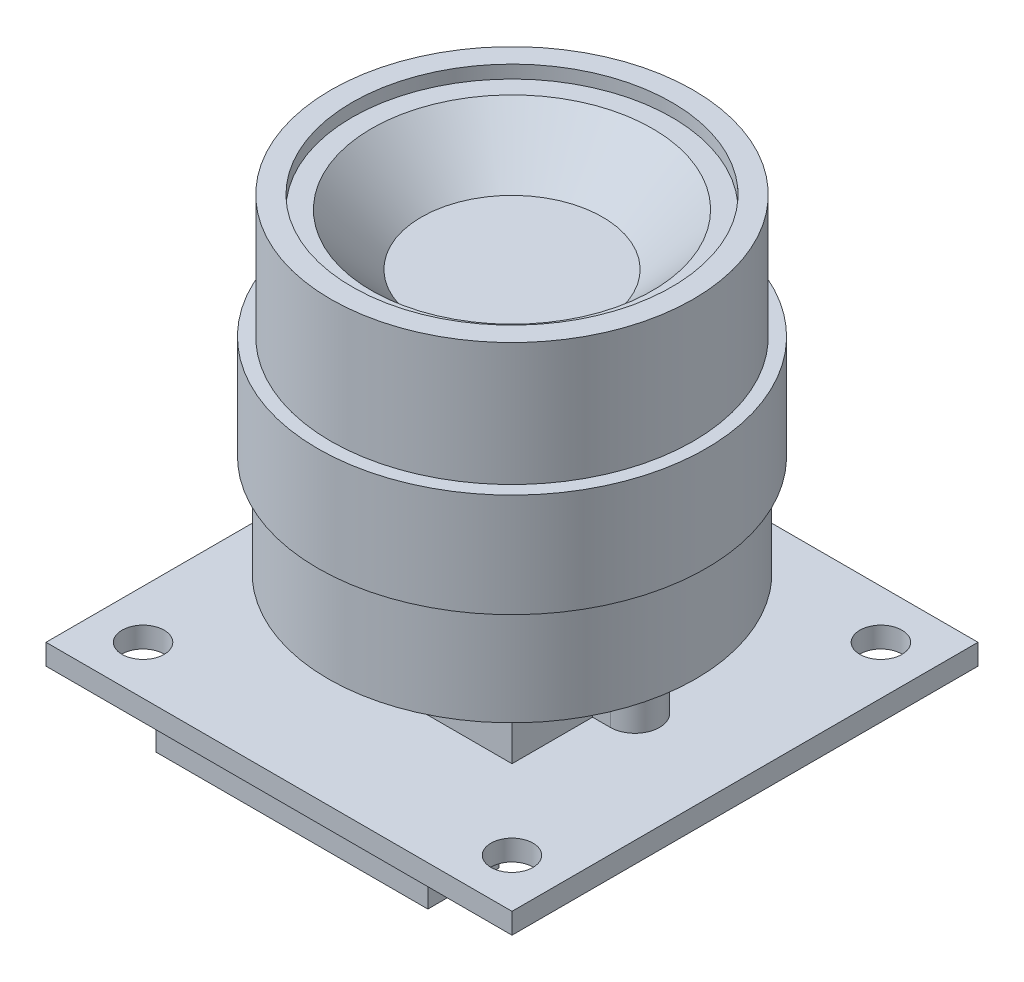
from build123d import *

# Parameters (mm, degrees)
SKETCH1_W                  = 36
SKETCH1_H                  = 36
BOSS_EXTRUDE1_DEPTH        = 1.6
F_3_2_3_2_DIAMETER_HOLE1_D = 3.25
BOSS_EXTRUDE2_DEPTH        = 4.65
SKETCH5_R                  = 14.2
BOSS_EXTRUDE3_DEPTH        = 7.8
SKETCH6_R                  = 15
BOSS_EXTRUDE4_DEPTH        = 8
SKETCH7_R                  = 14
BOSS_EXTRUDE5_DEPTH        = 9.5
SKETCH8_W                  = 21
SKETCH8_H                  = 5.5
BOSS_EXTRUDE6_DEPTH        = 2.5


with BuildPart() as part:
    # Sketch1 → Boss-Extrude1 (new body)
    with BuildSketch(Plane(origin=(0, 0, 0), x_dir=(1, 0, 0), z_dir=(0, 1, 0))):
        Rectangle(SKETCH1_W, SKETCH1_H)
    extrude(amount=BOSS_EXTRUDE1_DEPTH)

    # Ø3.2 (3.2) Diameter Hole1 (through all)
    with Locations(Plane(origin=(0, 1.6, 0), x_dir=(1, 0, 0), z_dir=(0, 1, 0))):
        with Locations((-14.25, 14.25), (14.25, 14.25), (14.25, -14.25), (-14.25, -14.25)):
            Hole(F_3_2_3_2_DIAMETER_HOLE1_D / 2)

    # Sketch4 → Boss-Extrude2 (add)
    with BuildSketch(Plane(origin=(0, 1.6, 0), x_dir=(1, 0, 0), z_dir=(0, 1, 0))):
        with BuildLine():
            Line((-8.125, -8.125), (8.125, -8.125))
            Line((8.125, -8.125), (8.125, -1.9))
            Line((8.125, -1.9), (9.5, -1.9))
            ThreePointArc((9.5, -1.9), (11.4, 0), (9.5, 1.9))
            Line((9.5, 1.9), (8.125, 1.9))
            Line((8.125, 1.9), (8.125, 8.125))
            Line((8.125, 8.125), (-8.125, 8.125))
            Line((-8.125, 8.125), (-8.125, 1.9))
            Line((-8.125, 1.9), (-9.5, 1.9))
            ThreePointArc((-9.5, 1.9), (-11.4, 0), (-9.5, -1.9))
            Line((-9.5, -1.9), (-8.125, -1.9))
            Line((-8.125, -1.9), (-8.125, -8.125))
        make_face()
    extrude(amount=BOSS_EXTRUDE2_DEPTH)

    # Sketch5 → Boss-Extrude3 (add)
    with BuildSketch(Plane(origin=(0, 6.25, 0), x_dir=(1, 0, 0), z_dir=(0, 1, 0))):
        Circle(SKETCH5_R)
    extrude(amount=BOSS_EXTRUDE3_DEPTH)

    # Sketch6 → Boss-Extrude4 (add)
    with BuildSketch(Plane(origin=(0, 14.05, 0), x_dir=(1, 0, 0), z_dir=(0, 1, 0))):
        Circle(SKETCH6_R)
    extrude(amount=BOSS_EXTRUDE4_DEPTH)

    # Sketch7 → Boss-Extrude5 (add)
    with BuildSketch(Plane(origin=(0, 22.05, 0), x_dir=(1, 0, 0), z_dir=(0, 1, 0))):
        Circle(SKETCH7_R)
    extrude(amount=BOSS_EXTRUDE5_DEPTH)

    # Sketch8 → Boss-Extrude6 (add)
    with BuildSketch(Plane.XZ):
        with Locations((0, 14.25)):
            Rectangle(SKETCH8_W, SKETCH8_H)
    extrude(amount=BOSS_EXTRUDE6_DEPTH)

    # Sketch9 → Cut-Revolve1 (revolve, cut)
    with BuildSketch(Plane.XY):
        Polygon((0, 31.55), (0, 26.55), (7, 26.55), (10.85, 30.55), (12.35, 30.55), (12.35, 31.55), align=None)
    revolve(axis=Axis((0, 31.55, 0), (0, -1, 0)), mode=Mode.SUBTRACT)


solid = part.part
